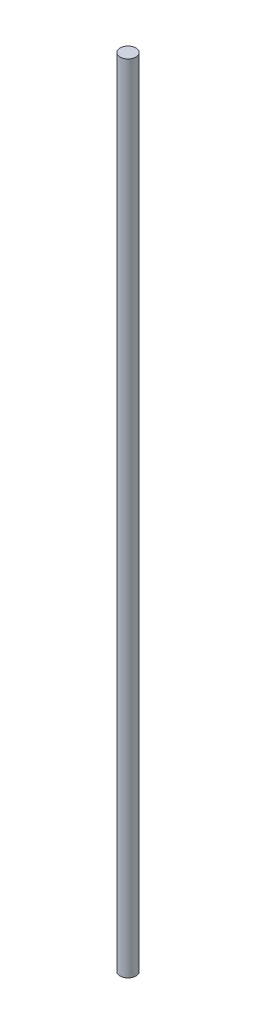
from build123d import *

# Parameters (mm, degrees)
SKETCH_1_R      = 0.75
EXTRUDE_1_DEPTH = 75


with BuildPart() as part:
    # 草图1 → 凸台-拉伸1 (new body)
    with BuildSketch(Plane(origin=(0, 0, 0), x_dir=(1, 0, 0), z_dir=(0, 1, 0))):
        Circle(SKETCH_1_R)
    extrude(amount=EXTRUDE_1_DEPTH)


solid = part.part
